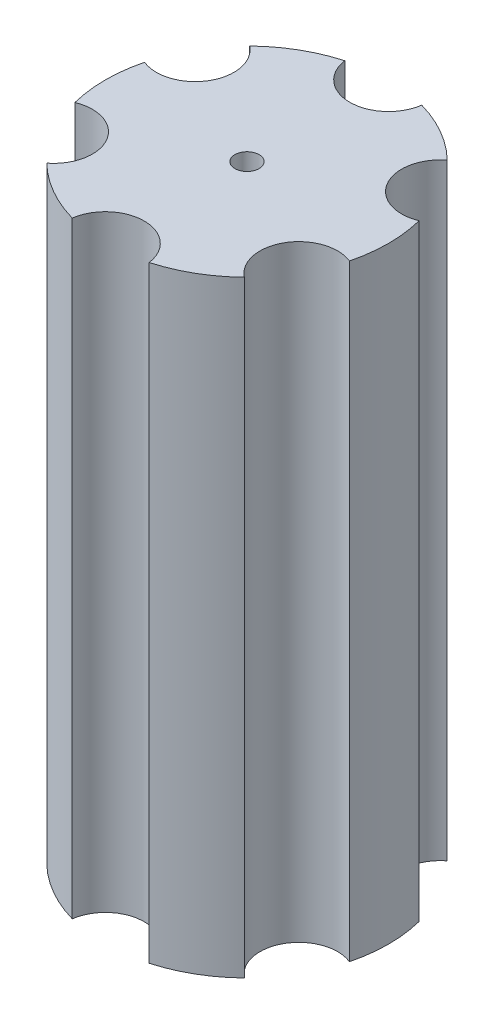
from build123d import *

# Parameters (mm, degrees)
SKETCH1_R           = 1.5
BOSS_EXTRUDE1_DEPTH = 75


with BuildPart() as part:
    # Sketch1 → Boss-Extrude1 (new body)
    with BuildSketch(Plane(origin=(0, 0, 0), x_dir=(1, 0, 0), z_dir=(0, 1, 0))):
        with BuildLine():
            ThreePointArc((-4.75464614, 16.841714286), (0, 12.7), (4.75464614, 16.841714286))
            ThreePointArc((4.75464614, 16.841714286), (8.75, 15.155444566), (12.208029345, 12.538501486))
            ThreePointArc((12.208029345, 12.538501486), (10.998522628, 6.35), (16.962675485, 4.303212799))
            ThreePointArc((16.962675485, 4.303212799), (17.5, 0), (16.962675485, -4.303212799))
            ThreePointArc((16.962675485, -4.303212799), (10.998522628, -6.35), (12.208029345, -12.538501486))
            ThreePointArc((12.208029345, -12.538501486), (8.75, -15.155444566), (4.75464614, -16.841714286))
            ThreePointArc((4.75464614, -16.841714286), (0, -12.7), (-4.75464614, -16.841714286))
            ThreePointArc((-4.75464614, -16.841714286), (-8.75, -15.155444566), (-12.208029345, -12.538501486))
            ThreePointArc((-12.208029345, -12.538501486), (-10.998522628, -6.35), (-16.962675485, -4.303212799))
            ThreePointArc((-16.962675485, -4.303212799), (-17.5, 0), (-16.962675485, 4.303212799))
            ThreePointArc((-16.962675485, 4.303212799), (-10.998522628, 6.35), (-12.208029345, 12.538501486))
            ThreePointArc((-12.208029345, 12.538501486), (-8.75, 15.155444566), (-4.75464614, 16.841714286))
        make_face()
        Circle(SKETCH1_R, mode=Mode.SUBTRACT)
    extrude(amount=BOSS_EXTRUDE1_DEPTH)


solid = part.part
